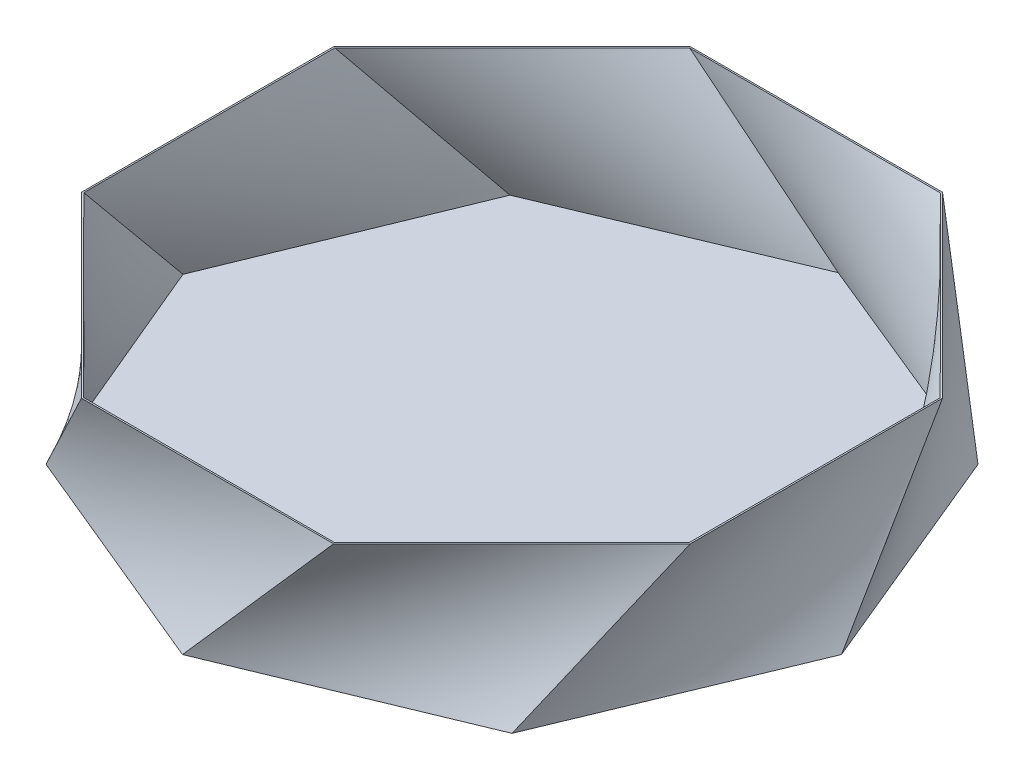
from build123d import *

# Parameters (mm, degrees)
SHELL3_T = -0.1


with BuildPart() as part:
    # Boundary1: read off the stored shape, not the designer's step
    # Boundary1: loft between two sections, ruled curve by curve
    boundary1_from = [
        Edge.make_bspline([(-20.787289482, 10, -8.610377228), (-8.610377228, 10, -20.787289482)], [0, 0, 1, 1], 1),
        Edge.make_bspline([(-8.610377228, 10, -20.787289482), (8.610377228, 10, -20.787289482)], [0, 0, 1, 1], 1),
        Edge.make_bspline([(8.610377228, 10, -20.787289482), (20.787289482, 10, -8.610377228)], [0, 0, 1, 1], 1),
        Edge.make_bspline([(20.787289482, 10, -8.610377228), (20.787289482, 10, 8.610377228)], [0, 0, 1, 1], 1),
        Edge.make_bspline([(20.787289482, 10, 8.610377228), (8.610377228, 10, 20.787289482)], [0, 0, 1, 1], 1),
        Edge.make_bspline([(8.610377228, 10, 20.787289482), (-8.610377228, 10, 20.787289482)], [0, 0, 1, 1], 1),
        Edge.make_bspline([(-8.610377228, 10, 20.787289482), (-20.787289482, 10, 8.610377228)], [0, 0, 1, 1], 1),
        Edge.make_bspline([(-20.787289482, 10, 8.610377228), (-20.787289482, 10, -8.610377228)], [0, 0, 1, 1], 1),
    ]
    boundary1_to = [
        Edge.make_bspline([(-15.909902577, 0, -15.909902577), (0, 0, -22.5)], [0, 0, 1, 1], 1),
        Edge.make_bspline([(0, 0, -22.5), (15.909902577, 0, -15.909902577)], [0, 0, 1, 1], 1),
        Edge.make_bspline([(15.909902577, 0, -15.909902577), (22.5, 0, 0)], [0, 0, 1, 1], 1),
        Edge.make_bspline([(22.5, 0, 0), (15.909902577, 0, 15.909902577)], [0, 0, 1, 1], 1),
        Edge.make_bspline([(15.909902577, 0, 15.909902577), (0, 0, 22.5)], [0, 0, 1, 1], 1),
        Edge.make_bspline([(0, 0, 22.5), (-15.909902577, 0, 15.909902577)], [0, 0, 1, 1], 1),
        Edge.make_bspline([(-15.909902577, 0, 15.909902577), (-22.5, 0, 0)], [0, 0, 1, 1], 1),
        Edge.make_bspline([(-22.5, 0, 0), (-15.909902577, 0, -15.909902577)], [0, 0, 1, 1], 1),
    ]
    boundary1 = Solid(Shell([*[Face.make_surface_from_curves(boundary1_from[k], boundary1_to[k]) for k in range(8)], Face(Wire(boundary1_from)), Face(Wire(boundary1_to))]))
    add(boundary1)

    # Shell3
    shell3_openings = [part.faces().sort_by_distance(p)[0] for p in [
        (0, 10, 0),
    ]]
    offset(amount=SHELL3_T, openings=shell3_openings, kind=Kind.INTERSECTION)


solid = part.part
